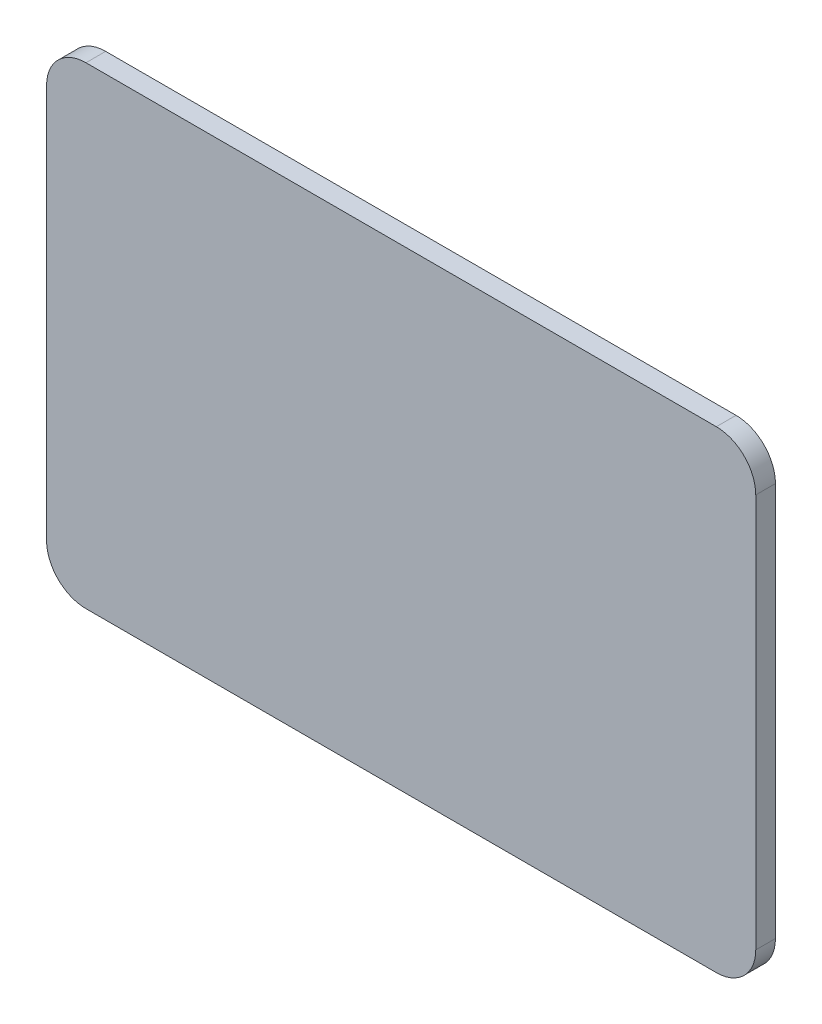
from build123d import *

# Parameters (mm, degrees)
SKETCH1_W           = 114.3
SKETCH1_H           = 76.2
BOSS_EXTRUDE1_DEPTH = 3.175
FILLET1_R           = 6.35


with BuildPart() as part:
    # Sketch1 → Boss-Extrude1 (new body)
    with BuildSketch(Plane.XY):
        Rectangle(SKETCH1_W, SKETCH1_H)
    extrude(amount=BOSS_EXTRUDE1_DEPTH)

    # Fillet1
    fillet1_edges = [part.edges().sort_by_distance(p)[0] for p in [
        (57.15, -38.1, 1.5875),
        (57.15, 38.1, 1.5875),
        (-57.15, 38.1, 1.5875),
        (-57.15, -38.1, 1.5875),
    ]]
    fillet(fillet1_edges, radius=FILLET1_R)


solid = part.part
